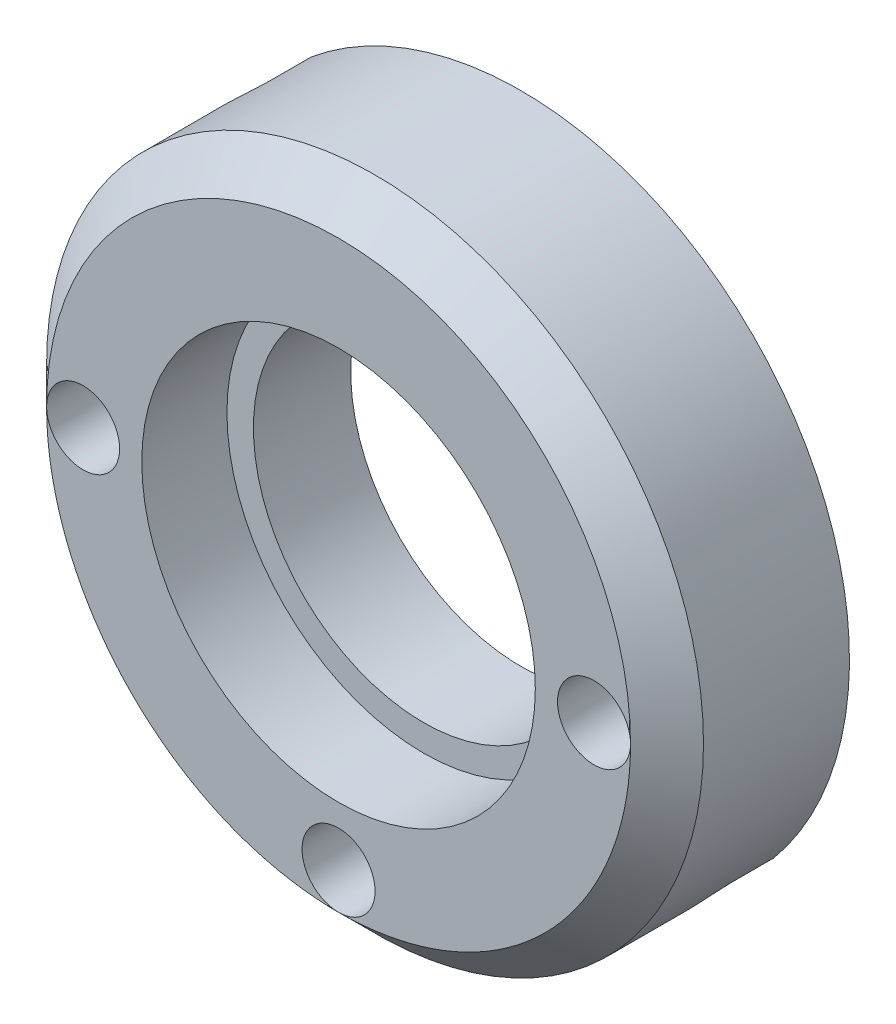
from build123d import *

# Parameters (mm, degrees)
SKETCH_1_R               = 27
EXTRUDE_415_DEPTH        = 15
SKETCH_2_R               = 16.175
CUT_EXTRUDE_558_DEPTH    = 7
SKETCH_3_R               = 14
CUT_EXTRUDE_649_DEPTH    = 40.012818406
SKETCH_5_R               = 1.65
CUT_EXTRUDE_974_DEPTH    = 42.024382994
SKETCH_6_R               = 3
CUT_EXTRUDE_1153_DEPTH   = 5
CHAMFER_1_SIZE           = 1.5
CHAMFER_2_SIZE           = 3
CUT_EXTRUDE_1_DEPTH      = 42.024382994
CUT_EXTRUDE_1_DEPTH_BACK = 42.024382994


# Some blends are built 0.0001 mm under size
with BuildPart() as part:
    # Эскиз1 → Extrude 415 (new body)
    with BuildSketch(Plane.XY):
        Circle(SKETCH_1_R)
    extrude(amount=EXTRUDE_415_DEPTH)

    # Эскиз2 → Cut-Extrude 558 (cut)
    with BuildSketch(Plane.XY.offset(15)):
        Circle(SKETCH_2_R)
    extrude(amount=-CUT_EXTRUDE_558_DEPTH, mode=Mode.SUBTRACT)

    # Эскиз3 → Cut-Extrude 649 (cut, through all)
    with BuildSketch(Plane.XY.offset(8)):
        Circle(SKETCH_3_R)
    extrude(amount=-CUT_EXTRUDE_649_DEPTH, mode=Mode.SUBTRACT)

    # Эскиз5 → Cut-Extrude 974 (cut, through all)
    with BuildSketch(Plane.XY.offset(15)):
        with Locations((-21, 0)):
            Circle(SKETCH_5_R)
        with Locations((21, 0)):
            Circle(SKETCH_5_R)
        with Locations((0, -21)):
            Circle(SKETCH_5_R)
    extrude(amount=-CUT_EXTRUDE_974_DEPTH, mode=Mode.SUBTRACT)

    # Эскиз6 → Cut-Extrude 1153 (cut)
    with BuildSketch(Plane.XY.offset(15)):
        with Locations((-21, 0)):
            Circle(SKETCH_6_R)
        with Locations((21, 0)):
            Circle(SKETCH_6_R)
        with Locations((0, -21)):
            Circle(SKETCH_6_R)
    extrude(amount=-CUT_EXTRUDE_1153_DEPTH, mode=Mode.SUBTRACT)

    # Фаска1
    # the kernel refuses this chamfer: 1.5 mm, written as the material it takes off along each edge
    with BuildSketch(Plane(origin=(0, -21, 10), x_dir=(1, 0, 0), z_dir=(0, -1, 0))) as chamfer_1_piece_1_section:
        Polygon((1.65, -CHAMFER_1_SIZE), (1.65 + CHAMFER_1_SIZE, 0), (1.65, 0), align=None)
    chamfer_1_piece_1 = revolve(axis=Axis((0, -21, 10), (0, 0, 1)), mode=Mode.PRIVATE)
    chamfer_1_piece_1 = chamfer_1_piece_1 & Plane(origin=(0, -21, 9.171694066), x_dir=(1, 0, 0), z_dir=(0, 0, 1)) * Cylinder(3, 13, mode=Mode.PRIVATE)
    add(chamfer_1_piece_1, mode=Mode.SUBTRACT)
    with BuildSketch(Plane(origin=(21, 0, 10), x_dir=(1, 0, 0), z_dir=(0, -1, 0))) as chamfer_1_piece_2_section:
        Polygon((1.65, -CHAMFER_1_SIZE), (1.65 + CHAMFER_1_SIZE, 0), (1.65, 0), align=None)
    chamfer_1_piece_2 = revolve(axis=Axis((21, 0, 10), (0, 0, 1)), mode=Mode.PRIVATE)
    chamfer_1_piece_2 = chamfer_1_piece_2 & Plane(origin=(21, 0, 9.171694066), x_dir=(1, 0, 0), z_dir=(0, 0, 1)) * Cylinder(3, 13, mode=Mode.PRIVATE)
    add(chamfer_1_piece_2, mode=Mode.SUBTRACT)
    with BuildSketch(Plane(origin=(-21, 0, 10), x_dir=(1, 0, 0), z_dir=(0, -1, 0))) as chamfer_1_piece_3_section:
        Polygon((1.65, -CHAMFER_1_SIZE), (1.65 + CHAMFER_1_SIZE, 0), (1.65, 0), align=None)
    chamfer_1_piece_3 = revolve(axis=Axis((-21, 0, 10), (0, 0, 1)), mode=Mode.PRIVATE)
    chamfer_1_piece_3 = chamfer_1_piece_3 & Plane(origin=(-21, 0, 9.171694066), x_dir=(1, 0, 0), z_dir=(0, 0, 1)) * Cylinder(3, 13, mode=Mode.PRIVATE)
    add(chamfer_1_piece_3, mode=Mode.SUBTRACT)

    # Фаска2
    chamfer_2_edges = [part.edges().sort_by_distance(p)[0] for p in [
        (-27, 0, 15),
    ]]
    chamfer(chamfer_2_edges, length=CHAMFER_2_SIZE - 0.0001)  # a hair under: the kernel refuses the full size

    # Эскиз7 → Вырез-Вытянуть1 (cut, two sides: drawn at the far end of the back side and taken through both)
    with BuildSketch(Plane(origin=(0, 0, 0), x_dir=(0, 0, -1), z_dir=(0.7071067811865511, -0.707106781186544, 0)).offset(-CUT_EXTRUDE_1_DEPTH_BACK)):
        with BuildLine():
            Line((0, 2.5), (-3, 2.5))
            ThreePointArc((-3, 2.5), (-5.5, 0), (-3, -2.5))
            Line((-3, -2.5), (0, -2.5))
            Line((0, -2.5), (0, 2.5))
        make_face()
    extrude(amount=CUT_EXTRUDE_1_DEPTH + CUT_EXTRUDE_1_DEPTH_BACK, mode=Mode.SUBTRACT)


solid = part.part
